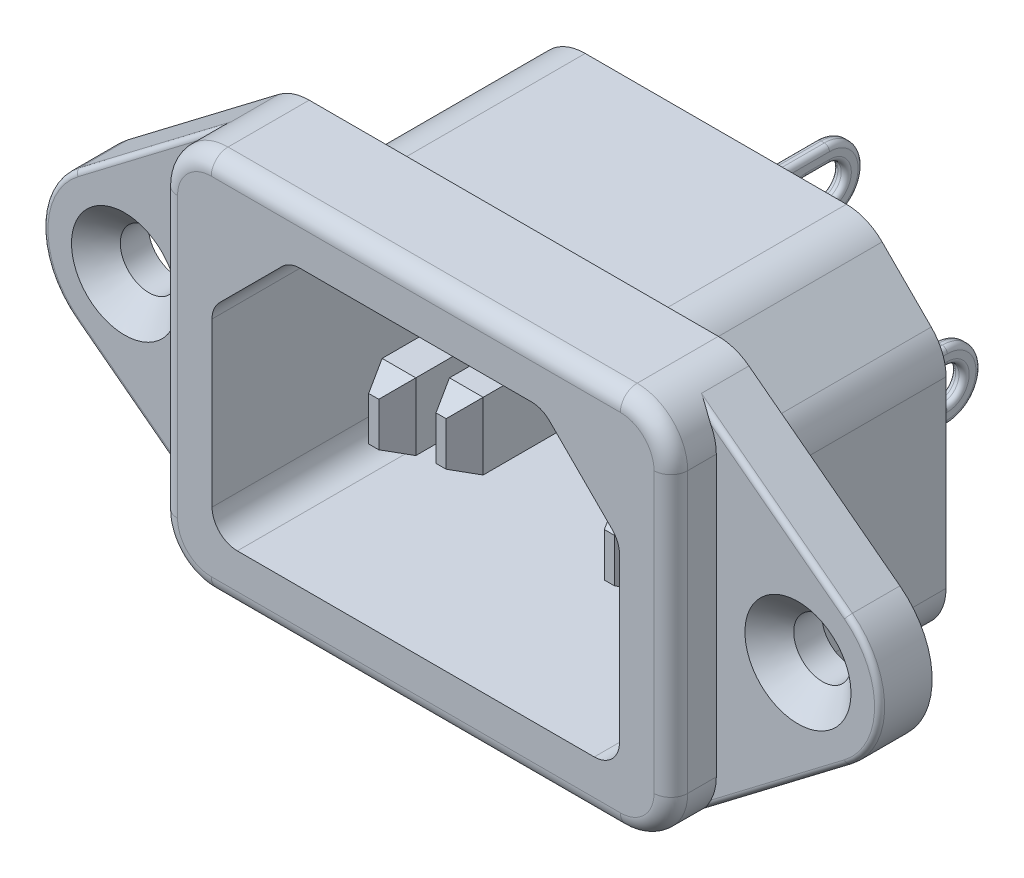
from build123d import *
from OCP.BRepFilletAPI import BRepFilletAPI_MakeChamfer

# Parameters (mm, degrees)
EXTRUDE_1_DEPTH             = 3.12
EXTRUDE_START               = 3.12
EXTRUDE_2_DEPTH             = 2.7
EXTRUDE_3_DEPTH             = 12
CUT_EXTRUDE_1_DEPTH         = 16
EXTRUDE_4_DEPTH             = 2.2
HOLE_WIZARD_M31_D           = 3.4
HOLE_WIZARD_M31_DEPTH       = 5
HOLE_WIZARD_M31_CSINK_D     = 6.3
HOLE_WIZARD_M31_CSINK_ANGLE = 90
HOLE_WIZARD_M31_TIP         = 1.021463052
SKETCH_8_W                  = 2
SKETCH_8_H                  = 4
EXTRUDE_5_DEPTH             = 6.75
SKETCH_10_W                 = 1.2
SKETCH_10_H                 = 4
CUT_EXTRUDE_3_DEPTH         = 5.95
CUT_EXTRUDE_2_DEPTH         = 41.567413031
CUT_EXTRUDE_4_DEPTH         = 41.567413031
SKETCH_12_W                 = 2
SKETCH_12_H                 = 4
EXTRUDE_6_DEPTH             = 11.5
SKETCH_12_3_W               = 2
SKETCH_12_3_H               = 4
EXTRUDE_7_DEPTH             = 14.5
CHAMFER_1_SIZE              = 0.7
CHAMFER_1_SIZE2             = 1.501154844
CHAMFER_2_SIZE              = 0.7
CHAMFER_2_SIZE2             = 1.501154844
FILLET_1_R                  = 1
FILLET_2_R                  = 0.3
FILLET_3_R                  = 0.3


with BuildPart() as part:
    # Эскиз1 → Бобышка-Вытянуть1 (new body)
    with BuildSketch(Plane.XY):
        with BuildLine():
            ThreePointArc((-15.15, 8.3), (-14.838027836, 9.632105984), (-13.966995764, 10.687158644))
            Line((-13.966995764, 10.687158644), (-22.937476485, 3.859239808))
            ThreePointArc((-22.937476485, 3.859239808), (-24.85, 0), (-22.937476485, -3.859239808))
            Line((-22.937476485, -3.859239808), (-13.966995764, -10.687158644))
            ThreePointArc((-13.966995764, -10.687158644), (-14.838027836, -9.632105984), (-15.15, -8.3))
            Line((-15.15, -8.3), (-15.15, 8.3))
        make_face()
        with BuildLine():
            Line((-12.15, 11.3), (12.15, 11.3))
            ThreePointArc((12.15, 11.3), (14.271320344, 10.421320344), (15.15, 8.3))
            Line((15.15, 8.3), (15.15, -8.3))
            ThreePointArc((15.15, -8.3), (14.271320344, -10.421320344), (12.15, -11.3))
            Line((12.15, -11.3), (-12.15, -11.3))
            ThreePointArc((-12.15, -11.3), (-14.271320344, -10.421320344), (-15.15, -8.3))
            Line((-15.15, -8.3), (-15.15, 8.3))
            ThreePointArc((-15.15, 8.3), (-14.271320344, 10.421320344), (-12.15, 11.3))
        make_face()
        with BuildLine():
            Line((22.937476485, 3.859239808), (13.966995764, 10.687158644))
            ThreePointArc((13.966995764, 10.687158644), (14.838027836, 9.632105984), (15.15, 8.3))
            Line((15.15, 8.3), (15.15, -8.3))
            ThreePointArc((15.15, -8.3), (14.838027836, -9.632105984), (13.966995764, -10.687158644))
            Line((13.966995764, -10.687158644), (22.937476485, -3.859239808))
            ThreePointArc((22.937476485, -3.859239808), (24.85, 0), (22.937476485, 3.859239808))
        make_face()
    extrude(amount=EXTRUDE_1_DEPTH)

    # Эскиз1<3> → Бобышка-Вытянуть2 (add)
    with BuildSketch(Plane.XY.offset(EXTRUDE_START)):
        with BuildLine():
            Line((-12.15, -11.3), (12.15, -11.3))
            ThreePointArc((12.15, -11.3), (14.271320344, -10.421320344), (15.15, -8.3))
            Line((15.15, -8.3), (15.15, 8.3))
            ThreePointArc((15.15, 8.3), (14.271320344, 10.421320344), (12.15, 11.3))
            Line((12.15, 11.3), (-12.15, 11.3))
            ThreePointArc((-12.15, 11.3), (-14.271320344, 10.421320344), (-15.15, 8.3))
            Line((-15.15, 8.3), (-15.15, -8.3))
            ThreePointArc((-15.15, -8.3), (-14.271320344, -10.421320344), (-12.15, -11.3))
        make_face()
    extrude(amount=EXTRUDE_2_DEPTH)

    # Эскиз3 → Бобышка-Вытянуть3 (add)
    with BuildSketch(Plane(origin=(0, 0, 0), x_dir=(-1, 0, 0), z_dir=(0, 0, -1))):
        with BuildLine():
            Line((-13.675, -6.9), (-13.675, 3.982359313))
            ThreePointArc((-13.675, 3.982359313), (-13.446638598, 5.13040961), (-12.796320344, 6.103679656))
            Line((-12.796320344, 6.103679656), (-9.878679656, 9.021320344))
            ThreePointArc((-9.878679656, 9.021320344), (-8.90540961, 9.671638598), (-7.757359313, 9.9))
            Line((-7.757359313, 9.9), (7.757359313, 9.9))
            ThreePointArc((7.757359313, 9.9), (8.90540961, 9.671638598), (9.878679656, 9.021320344))
            Line((9.878679656, 9.021320344), (12.796320344, 6.103679656))
            ThreePointArc((12.796320344, 6.103679656), (13.446638598, 5.13040961), (13.675, 3.982359313))
            Line((13.675, 3.982359313), (13.675, -6.9))
            ThreePointArc((13.675, -6.9), (12.796320344, -9.021320344), (10.675, -9.9))
            Line((10.675, -9.9), (-10.675, -9.9))
            ThreePointArc((-10.675, -9.9), (-12.796320344, -9.021320344), (-13.675, -6.9))
        make_face()
    extrude(amount=EXTRUDE_3_DEPTH)

    # Эскиз4 → Вырез-Вытянуть1 (cut)
    with BuildSketch(Plane.XY.offset(5.82)):
        with BuildLine():
            Line((-11.660660172, 4.039339828), (-7.939339828, 7.760660172))
            ThreePointArc((-7.939339828, 7.760660172), (-7.452704805, 8.085819299), (-6.878679656, 8.2))
            Line((-6.878679656, 8.2), (6.878679656, 8.2))
            ThreePointArc((6.878679656, 8.2), (7.452704805, 8.085819299), (7.939339828, 7.760660172))
            Line((7.939339828, 7.760660172), (11.660660172, 4.039339828))
            ThreePointArc((11.660660172, 4.039339828), (11.985819299, 3.552704805), (12.1, 2.978679656))
            Line((12.1, 2.978679656), (12.1, -6.7))
            ThreePointArc((12.1, -6.7), (11.660660172, -7.760660172), (10.6, -8.2))
            Line((10.6, -8.2), (-10.6, -8.2))
            ThreePointArc((-10.6, -8.2), (-11.660660172, -7.760660172), (-12.1, -6.7))
            Line((-12.1, -6.7), (-12.1, 2.978679656))
            ThreePointArc((-12.1, 2.978679656), (-11.985819299, 3.552704805), (-11.660660172, 4.039339828))
        make_face()
    extrude(amount=-CUT_EXTRUDE_1_DEPTH, mode=Mode.SUBTRACT)

    # Эскиз5 → Бобышка-Вытянуть4 (add)
    with BuildSketch(Plane(origin=(0, 0, -12), x_dir=(-1, 0, 0), z_dir=(0, 0, -1))):
        with BuildLine():
            Line((8.5, -7.65), (5.5, -7.65))
            ThreePointArc((5.5, -7.65), (4.792893219, -7.357106781), (4.5, -6.65))
            Line((4.5, -6.65), (4.5, -0.3))
            ThreePointArc((4.5, -0.3), (4.792893219, 0.407106781), (5.5, 0.7))
            Line((5.5, 0.7), (8.5, 0.7))
            ThreePointArc((8.5, 0.7), (9.207106781, 0.407106781), (9.5, -0.3))
            Line((9.5, -0.3), (9.5, -6.65))
            ThreePointArc((9.5, -6.65), (9.207106781, -7.357106781), (8.5, -7.65))
        make_face()
        with BuildLine():
            Line((-5.5, -7.65), (-8.5, -7.65))
            ThreePointArc((-8.5, -7.65), (-9.207106781, -7.357106781), (-9.5, -6.65))
            Line((-9.5, -6.65), (-9.5, -0.3))
            ThreePointArc((-9.5, -0.3), (-9.207106781, 0.407106781), (-8.5, 0.7))
            Line((-8.5, 0.7), (-5.5, 0.7))
            ThreePointArc((-5.5, 0.7), (-4.792893219, 0.407106781), (-4.5, -0.3))
            Line((-4.5, -0.3), (-4.5, -6.65))
            ThreePointArc((-4.5, -6.65), (-4.792893219, -7.357106781), (-5.5, -7.65))
        make_face()
        with BuildLine():
            Line((1.5, -0.7), (-1.5, -0.7))
            ThreePointArc((-1.5, -0.7), (-2.207106781, -0.407106781), (-2.5, 0.3))
            Line((-2.5, 0.3), (-2.5, 6.65))
            ThreePointArc((-2.5, 6.65), (-2.207106781, 7.357106781), (-1.5, 7.65))
            Line((-1.5, 7.65), (1.5, 7.65))
            ThreePointArc((1.5, 7.65), (2.207106781, 7.357106781), (2.5, 6.65))
            Line((2.5, 6.65), (2.5, 0.3))
            ThreePointArc((2.5, 0.3), (2.207106781, -0.407106781), (1.5, -0.7))
        make_face()
    extrude(amount=EXTRUDE_4_DEPTH)

    # Зенковка для винта с полупотайной головкой M31
    with Locations(Plane.XY.offset(3.12)):
        with Locations((-20, 0), (20, 0)):
            CounterSinkHole(HOLE_WIZARD_M31_D / 2, HOLE_WIZARD_M31_CSINK_D / 2, depth=HOLE_WIZARD_M31_DEPTH, counter_sink_angle=HOLE_WIZARD_M31_CSINK_ANGLE)
            with Locations((0, 0, -(HOLE_WIZARD_M31_DEPTH + HOLE_WIZARD_M31_TIP / 2))):  # 118° drill point
                Cone(0, HOLE_WIZARD_M31_D / 2, HOLE_WIZARD_M31_TIP, mode=Mode.SUBTRACT)

    # Эскиз8 → Бобышка-Вытянуть5 (add)
    with BuildSketch(Plane(origin=(0, 0, -14.2), x_dir=(-1, 0, 0), z_dir=(0, 0, -1))):
        with Locations((0, 3.45)):
            Rectangle(SKETCH_8_W, SKETCH_8_H)
        with Locations((7, -3.45)):
            Rectangle(SKETCH_8_W, SKETCH_8_H)
        with Locations((-7, -3.45)):
            Rectangle(SKETCH_8_W, SKETCH_8_H)
    extrude(amount=EXTRUDE_5_DEPTH)

    # Эскиз10 → Вырез-Вытянуть3 (cut)
    with BuildSketch(Plane(origin=(0, 0, -20.95), x_dir=(-1, 0, 0), z_dir=(0, 0, -1))):
        with Locations((-0.4, 3.45)):
            Rectangle(SKETCH_10_W, SKETCH_10_H)
        with Locations((-7.4, -3.45)):
            Rectangle(SKETCH_10_W, SKETCH_10_H)
        with Locations((6.6, -3.45)):
            Rectangle(SKETCH_10_W, SKETCH_10_H)
    extrude(amount=-CUT_EXTRUDE_3_DEPTH, mode=Mode.SUBTRACT)

    # Эскиз9 → Вырез-Вытянуть2 (cut, through all)
    with BuildSketch(Plane.ZY.offset(8)):
        with BuildLine():
            Line((-20.95, 3.450000016), (-20.95, 1.45))
            Line((-20.95, 1.45), (-18.95, 1.45))
            ThreePointArc((-18.95, 1.45), (-20.364213568, 2.035786443), (-20.95, 3.450000016))
        make_face()
        with BuildLine():
            Line((-20.95, 5.45), (-20.95, 3.450000016))
            ThreePointArc((-20.95, 3.450000016), (-20.364213557, 4.864213568), (-18.95, 5.45))
            Line((-18.95, 5.45), (-20.95, 5.45))
        make_face()
        with BuildLine():
            Line((-20.95, -1.45), (-20.95, -3.450000008))
            ThreePointArc((-20.95, -3.450000008), (-20.364213565, -2.03578644), (-18.95, -1.45))
            Line((-18.95, -1.45), (-20.95, -1.45))
        make_face()
        with BuildLine():
            Line((-20.95, -3.450000008), (-20.95, -5.45))
            Line((-20.95, -5.45), (-18.95, -5.45))
            ThreePointArc((-18.95, -5.45), (-20.36421356, -4.864213565), (-20.95, -3.450000008))
        make_face()
    extrude(amount=-CUT_EXTRUDE_2_DEPTH, mode=Mode.SUBTRACT)

    # Эскиз11 → Вырез-Вытянуть4 (cut, through all)
    with BuildSketch(Plane.ZY.offset(8)):
        with BuildLine():
            Line((-18.95, -2.45), (-17.55, -2.45))
            ThreePointArc((-17.55, -2.45), (-16.55, -3.45), (-17.55, -4.45))
            Line((-17.55, -4.45), (-18.95, -4.45))
            ThreePointArc((-18.95, -4.45), (-19.95, -3.45), (-18.95, -2.45))
        make_face()
        with BuildLine():
            Line((-18.95, 4.45), (-17.55, 4.45))
            ThreePointArc((-17.55, 4.45), (-16.55, 3.45), (-17.55, 2.45))
            Line((-17.55, 2.45), (-18.95, 2.45))
            ThreePointArc((-18.95, 2.45), (-19.95, 3.45), (-18.95, 4.45))
        make_face()
    extrude(amount=-CUT_EXTRUDE_4_DEPTH, mode=Mode.SUBTRACT)

    # Эскиз12 → Бобышка-Вытянуть6 (add)
    with BuildSketch(Plane.XY.offset(-10.18)):
        with Locations((7, -2)):
            Rectangle(SKETCH_12_W, SKETCH_12_H)
        with Locations((-7, -2)):
            Rectangle(SKETCH_12_W, SKETCH_12_H)
    extrude(amount=EXTRUDE_6_DEPTH)

    # Эскиз12<3> → Бобышка-Вытянуть7 (add)
    with BuildSketch(Plane.XY.offset(-10.18)):
        with Locations((0, 2)):
            Rectangle(SKETCH_12_3_W, SKETCH_12_3_H)
    extrude(amount=EXTRUDE_7_DEPTH)

    # Фаска1: one chamfer whose edges measure the first distance from different faces: ONE call of the kernel's chamfer builder (chamfer() names one face for all edges)
    chamfer_1_edges_1 = [part.edges().sort_by_distance(p)[0] for p in [
        (-8, -2, 1.32),
        (-6, -2, 1.32),
    ]]
    chamfer_1_side_1 = [part.faces().sort_by_distance(p)[0] for p in [
        (-7, -2, 1.32),
    ]]
    chamfer_1_edges_2 = [part.edges().sort_by_distance(p)[0] for p in [
        (6, -2, 1.32),
        (8, -2, 1.32),
    ]]
    chamfer_1_side_2 = [part.faces().sort_by_distance(p)[0] for p in [
        (7, -2, 1.32),
    ]]
    chamfer_1_edges_3 = [part.edges().sort_by_distance(p)[0] for p in [
        (-1, 2, 4.32),
        (1, 2, 4.32),
    ]]
    chamfer_1_side_3 = [part.faces().sort_by_distance(p)[0] for p in [
        (0, 2, 4.32),
    ]]
    chamfer_1 = BRepFilletAPI_MakeChamfer(part.part.solid().wrapped)
    for e in chamfer_1_edges_1:
        chamfer_1.Add(CHAMFER_1_SIZE, CHAMFER_1_SIZE2, e.wrapped, chamfer_1_side_1[0].wrapped)  # the first distance lies on this face
    for e in chamfer_1_edges_2:
        chamfer_1.Add(CHAMFER_1_SIZE, CHAMFER_1_SIZE2, e.wrapped, chamfer_1_side_2[0].wrapped)  # the first distance lies on this face
    for e in chamfer_1_edges_3:
        chamfer_1.Add(CHAMFER_1_SIZE, CHAMFER_1_SIZE2, e.wrapped, chamfer_1_side_3[0].wrapped)  # the first distance lies on this face
    add(Compound.cast(chamfer_1.Shape()), mode=Mode.REPLACE)

    # Фаска2: one chamfer whose edges measure the first distance from different faces: ONE call of the kernel's chamfer builder (chamfer() names one face for all edges)
    chamfer_2_edges_1 = [part.edges().sort_by_distance(p)[0] for p in [
        (-7, 0, 1.32),
        (-7, -4, 1.32),
    ]]
    chamfer_2_side_1 = [part.faces().sort_by_distance(p)[0] for p in [
        (-7, -2, 1.32),
    ]]
    chamfer_2_edges_2 = [part.edges().sort_by_distance(p)[0] for p in [
        (7, 0, 1.32),
        (7, -4, 1.32),
    ]]
    chamfer_2_side_2 = [part.faces().sort_by_distance(p)[0] for p in [
        (7, -2, 1.32),
    ]]
    chamfer_2_edges_3 = [part.edges().sort_by_distance(p)[0] for p in [
        (0, 4, 4.32),
        (0, 0, 4.32),
    ]]
    chamfer_2_side_3 = [part.faces().sort_by_distance(p)[0] for p in [
        (0, 2, 4.32),
    ]]
    chamfer_2 = BRepFilletAPI_MakeChamfer(part.part.solid().wrapped)
    for e in chamfer_2_edges_1:
        chamfer_2.Add(CHAMFER_2_SIZE, CHAMFER_2_SIZE2, e.wrapped, chamfer_2_side_1[0].wrapped)  # the first distance lies on this face
    for e in chamfer_2_edges_2:
        chamfer_2.Add(CHAMFER_2_SIZE, CHAMFER_2_SIZE2, e.wrapped, chamfer_2_side_2[0].wrapped)  # the first distance lies on this face
    for e in chamfer_2_edges_3:
        chamfer_2.Add(CHAMFER_2_SIZE, CHAMFER_2_SIZE2, e.wrapped, chamfer_2_side_3[0].wrapped)  # the first distance lies on this face
    add(Compound.cast(chamfer_2.Shape()), mode=Mode.REPLACE)

    # Скругление1
    fillet_1_edges = [part.edges().sort_by_distance(p)[0] for p in [
        (-15.15, 0, 5.82),
        (0, -11.3, 5.82),
        (14.271320344, 10.421320344, 5.82),
        (0, 11.3, 5.82),
        (-14.271320344, 10.421320344, 5.82),
        (-14.271320344, -10.421320344, 5.82),
        (14.271320344, -10.421320344, 5.82),
        (15.15, 0, 5.82),
    ]]
    fillet(fillet_1_edges, radius=FILLET_1_R)

    # Скругление2
    # the kernel refuses this fillet: 0.3 mm, written as the material it takes off along each edge
    with BuildSketch(Plane(origin=(13.370206103, -11.141407585, 3.12), x_dir=(-0.6056652546959796, 0.7957195481160771, 0), z_dir=(0.7957195481160773, 0.6056652546959798, 0))) as fillet_2_piece_1_section:
        with BuildLine():
            CenterArc((FILLET_2_R, -FILLET_2_R), FILLET_2_R, 90, 90)
            Line((0, -FILLET_2_R), (0, 0))
            Line((0, 0), (FILLET_2_R, 0))
        make_face()
    fillet_2_piece_1 = extrude(amount=12.023420067, mode=Mode.PRIVATE)
    fillet_2_piece_1 = fillet_2_piece_1 - Plane(origin=(12.15, -8.3, 3.049941276), x_dir=(1, 0, 0), z_dir=(0, 0, -1)) * Cylinder(3, 26, mode=Mode.PRIVATE)
    add(fillet_2_piece_1, mode=Mode.SUBTRACT)
    with BuildSketch(Plane(origin=(20, 0, 3.12), x_dir=(0.6056652546959801, -0.795719548116077, 0), z_dir=(-0.795719548116077, -0.6056652546959801, 0))) as fillet_2_piece_2:
        with BuildLine():
            CenterArc((4.85 - FILLET_2_R, -FILLET_2_R), FILLET_2_R, 0, 90)
            Line((4.85, -FILLET_2_R), (4.85, 0))
            Line((4.85, 0), (4.85 - FILLET_2_R, 0))
        make_face()
    revolve(axis=Axis((20, 0, 3.12), (0, 0, 1)), revolution_arc=105.446543384, mode=Mode.SUBTRACT)
    with BuildSketch(Plane(origin=(22.937476485, 3.859239808, 3.12), x_dir=(0, 0, -1), z_dir=(-0.7957195481160769, 0.6056652546959801, 0))) as fillet_2_piece_3_section:
        with BuildLine():
            CenterArc((FILLET_2_R, FILLET_2_R), FILLET_2_R, 180, 90)
            Line((0, FILLET_2_R), (0, 0))
            Line((0, 0), (FILLET_2_R, 0))
        make_face()
    fillet_2_piece_3 = extrude(amount=12.023420067, mode=Mode.PRIVATE)
    fillet_2_piece_3 = fillet_2_piece_3 - Plane(origin=(12.15, 8.3, 3.049941723), x_dir=(0, 1, 0), z_dir=(0, 0, -1)) * Cylinder(3, 26, mode=Mode.PRIVATE)
    add(fillet_2_piece_3, mode=Mode.SUBTRACT)
    with BuildSketch(Plane(origin=(-13.370206103, 11.141407585, 3.12), x_dir=(0.60566525469598, -0.7957195481160769, 0), z_dir=(-0.795719548116077, -0.60566525469598, 0))) as fillet_2_piece_4_section:
        with BuildLine():
            CenterArc((FILLET_2_R, -FILLET_2_R), FILLET_2_R, 90, 90)
            Line((0, -FILLET_2_R), (0, 0))
            Line((0, 0), (FILLET_2_R, 0))
        make_face()
    fillet_2_piece_4 = extrude(amount=12.023420067, mode=Mode.PRIVATE)
    fillet_2_piece_4 = fillet_2_piece_4 - Plane(origin=(-12.15, 8.3, 3.049941265), x_dir=(-1, 0, 0), z_dir=(0, 0, -1)) * Cylinder(3, 26, mode=Mode.PRIVATE)
    add(fillet_2_piece_4, mode=Mode.SUBTRACT)
    with BuildSketch(Plane(origin=(-20, 0, 3.12), x_dir=(-0.6056652546959799, 0.795719548116077, 0), z_dir=(0.795719548116077, 0.6056652546959799, 0))) as fillet_2_piece_5:
        with BuildLine():
            CenterArc((4.85 - FILLET_2_R, -FILLET_2_R), FILLET_2_R, 0, 90)
            Line((4.85, -FILLET_2_R), (4.85, 0))
            Line((4.85, 0), (4.85 - FILLET_2_R, 0))
        make_face()
    revolve(axis=Axis((-20, 0, 3.12), (0, 0, 1)), revolution_arc=105.446543384, mode=Mode.SUBTRACT)
    with BuildSketch(Plane(origin=(-22.937476485, -3.859239808, 3.12), x_dir=(0.6056652546959793, 0.7957195481160774, 0), z_dir=(0.7957195481160775, -0.6056652546959794, 0))) as fillet_2_piece_6_section:
        with BuildLine():
            CenterArc((FILLET_2_R, -FILLET_2_R), FILLET_2_R, 90, 90)
            Line((0, -FILLET_2_R), (0, 0))
            Line((0, 0), (FILLET_2_R, 0))
        make_face()
    fillet_2_piece_6 = extrude(amount=12.023420067, mode=Mode.PRIVATE)
    fillet_2_piece_6 = fillet_2_piece_6 - Plane(origin=(-12.15, -8.3, 3.049941711), x_dir=(0, -1, 0), z_dir=(0, 0, -1)) * Cylinder(3, 26, mode=Mode.PRIVATE)
    add(fillet_2_piece_6, mode=Mode.SUBTRACT)

    # Скругление3
    fillet_3_edges = [part.edges().sort_by_distance(p)[0] for p in [
        (8, -5.45, -14.6),
        (8, -1.45, -14.6),
        (-6, -5.45, -14.6),
        (-6, -1.45, -14.6),
        (1, 1.45, -14.6),
        (1, 5.45, -14.6),
        (-0.2, 5.45, -16.975),
        (-0.2, 1.45, -16.975),
        (6.8, -1.45, -16.975),
        (6.8, -5.45, -16.975),
        (-7.2, -1.45, -16.975),
        (-7.2, -5.45, -16.975),
        (-0.2, 3.45, -20.95),
        (-7.2, -3.45, -20.95),
        (6, -5.45, -16.575),
        (-8, -5.45, -16.575),
        (-1, 1.45, -16.575),
        (-1, 3.45, -20.95),
        (6, -3.45, -20.95),
        (-8, -3.45, -20.95),
        (6.8, -3.45, -20.95),
        (6, -1.45, -16.575),
        (-8, -1.45, -16.575),
        (-1, 5.45, -16.575),
        (-0.2, 2.45, -18.25),
        (-0.2, 3.45, -16.55),
        (-0.2, 4.45, -18.25),
        (-0.2, 3.45, -19.95),
        (-7.2, -4.45, -18.25),
        (-7.2, -3.45, -16.55),
        (-7.2, -2.45, -18.25),
        (-7.2, -3.45, -19.95),
        (6, -3.45, -19.95),
        (6.8, -3.45, -19.95),
        (6, -2.45, -18.25),
        (6.8, -2.45, -18.25),
        (6, -3.45, -16.55),
        (6.8, -3.45, -16.55),
        (6, -4.45, -18.25),
        (6.8, -4.45, -18.25),
        (-8, -3.45, -19.95),
        (-8, -4.45, -18.25),
        (-8, -3.45, -16.55),
        (-8, -2.45, -18.25),
        (-1, 3.45, -19.95),
        (-1, 4.45, -18.25),
        (-1, 3.45, -16.55),
        (-1, 2.45, -18.25),
    ]]
    fillet(fillet_3_edges, radius=FILLET_3_R)


solid = part.part
